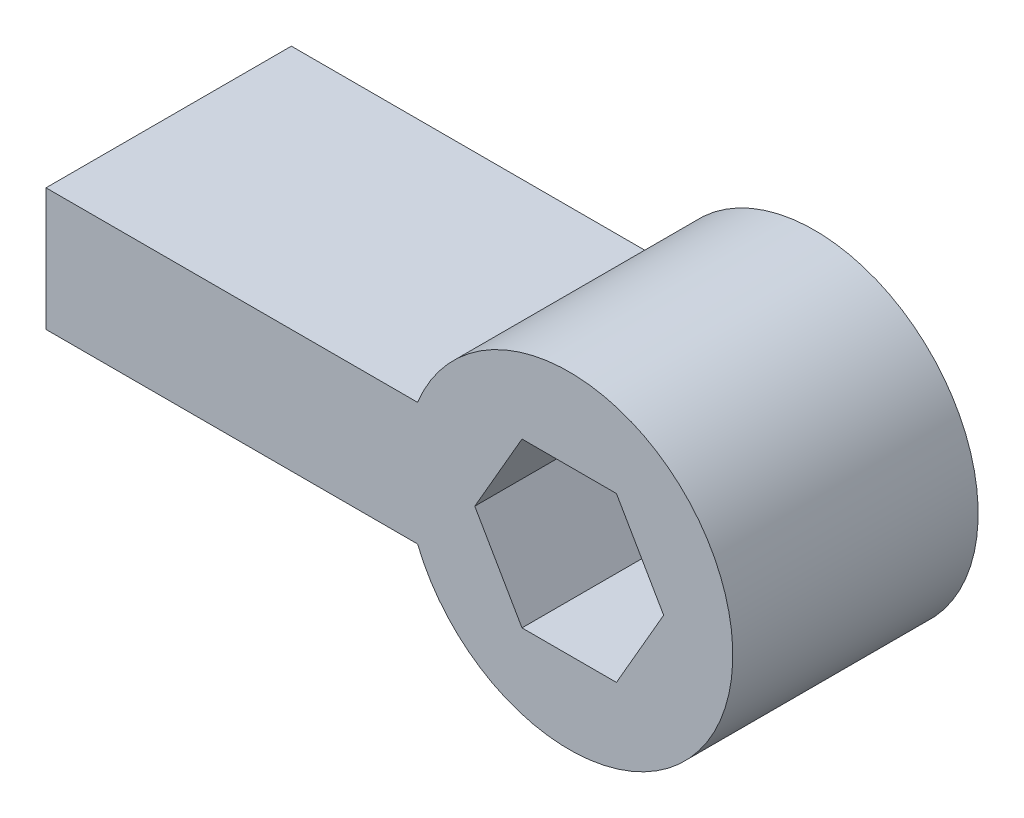
from build123d import *

# Parameters (mm, degrees)
SKETCH1_R                = 4
BOSS_EXTRUDE1_DEPTH      = 6
BOSS_EXTRUDE2_DEPTH      = 1.5
BOSS_EXTRUDE2_DEPTH_BACK = 1.5


with BuildPart() as part:
    # Sketch1 → Boss-Extrude1 (new body)
    with BuildSketch(Plane.XY):
        with Locations((5.549376682, 2)):
            Circle(SKETCH1_R)
        Polygon((4.394676144, 0), (6.704077221, 0), (7.858777759, 2), (6.704077221, 4), (4.394676144, 4), (3.239975606, 2), align=None, mode=Mode.SUBTRACT)
    extrude(amount=BOSS_EXTRUDE1_DEPTH)

    # Sketch2 → Boss-Extrude2 (add, two sides: drawn at the far end of the back side and taken through both)
    with BuildSketch(Plane(origin=(0, 2, 0), x_dir=(1, 0, 0), z_dir=(0, 1, 0)).offset(-BOSS_EXTRUDE2_DEPTH_BACK)):
        Polygon((3.239975606, 0), (1.549376682, 0), (-7.245305078, 0), (-7.245305078, -6), (1.549376682, -6), (3.239975606, -6), align=None)
    extrude(amount=BOSS_EXTRUDE2_DEPTH + BOSS_EXTRUDE2_DEPTH_BACK)


solid = part.part
